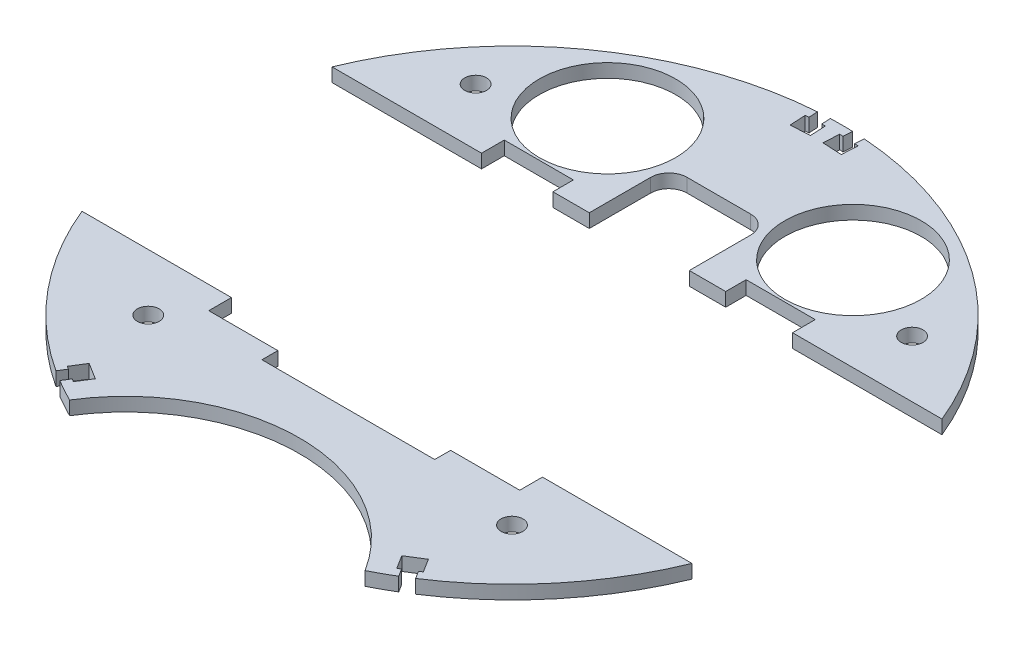
from build123d import *

# Parameters (mm, degrees)
BOSS_EXTRUDE1_DEPTH  = 3
SOLENOID_PLACEMENT_W = 38
SOLENOID_PLACEMENT_H = 64
CUT_EXTRUDE1_DEPTH   = 103.574363269
SKETCH3_R            = 12
CUT_EXTRUDE3_DEPTH   = 103.574363269
SKETCH4_R            = 2.4
CUT_EXTRUDE4_DEPTH   = 103.574363269
CUT_EXTRUDE2_DEPTH   = 103.574363269
CUT_EXTRUDE5_DEPTH   = 99.819279495
SKETCH6_R            = 15
CUT_EXTRUDE10_DEPTH  = 99.819279495
CUT_EXTRUDE11_DEPTH  = 99.819279495


with BuildPart() as part:
    # Sketch1 → Boss-Extrude1 (new body)
    with BuildSketch(Plane(origin=(0, 0, 0), x_dir=(1, 0, 0), z_dir=(0, 1, 0))):
        with BuildLine():
            ThreePointArc((32.48910875, -64.812867647), (0, 72.5), (-32.48910875, -64.812867647))
            ThreePointArc((-32.48910875, -64.812867647), (0, -46.75), (32.48910875, -64.812867647))
        make_face()
    extrude(amount=BOSS_EXTRUDE1_DEPTH)

    # solenoid placement → Cut-Extrude1 (cut, through all)
    with BuildSketch(Plane(origin=(0, 3, 0), x_dir=(1, 0, 0), z_dir=(0, 1, 0))):
        with Locations((0, -4)):
            Rectangle(SOLENOID_PLACEMENT_W, SOLENOID_PLACEMENT_H)
    extrude(amount=-CUT_EXTRUDE1_DEPTH, mode=Mode.SUBTRACT)

    # Sketch3 → Cut-Extrude3 (cut, through all)
    with BuildSketch(Plane(origin=(0, 3, 0), x_dir=(1, 0, 0), z_dir=(0, 1, 0))):
        with Locations((27, 48)):
            Circle(SKETCH3_R)
        with Locations((-27, 48)):
            Circle(SKETCH3_R)
    extrude(amount=-CUT_EXTRUDE3_DEPTH, mode=Mode.SUBTRACT)

    # Sketch4 → Cut-Extrude4 (cut, through all)
    with BuildSketch(Plane(origin=(0, 3, 0), x_dir=(1, 0, 0), z_dir=(0, 1, 0))):
        with Locations((40, -40)):
            Circle(SKETCH4_R)
        with Locations((-40, -40)):
            Circle(SKETCH4_R)
        with Locations((48, 40)):
            Circle(SKETCH4_R)
        with Locations((-48, 40)):
            Circle(SKETCH4_R)
    extrude(amount=-CUT_EXTRUDE4_DEPTH, mode=Mode.SUBTRACT)

    # Sketch2 → Cut-Extrude2 (cut, through all)
    with BuildSketch(Plane(origin=(0, 3, 0), x_dir=(1, 0, 0), z_dir=(0, 1, 0))):
        with BuildLine():
            Line((34.2, -27.5), (34.2, -32.5))
            Line((34.2, -32.5), (22.2, -32.5))
            Line((22.2, -32.5), (19, -32.5))
            Line((19, -32.5), (19, 32.5))
            Line((19, 32.5), (22.2, 32.5))
            Line((22.2, 32.5), (34.2, 32.5))
            Line((34.2, 32.5), (34.2, 27.5))
            Line((34.2, 27.5), (67.082039325, 27.5))
            ThreePointArc((67.082039325, 27.5), (72.5, 0), (67.082039325, -27.5))
            Line((67.082039325, -27.5), (34.2, -27.5))
        make_face()
        with BuildLine():
            Line((-34.2, -32.5), (-22.2, -32.5))
            Line((-22.2, -32.5), (-19, -32.5))
            Line((-19, -32.5), (-19, 32.5))
            Line((-19, 32.5), (-22.2, 32.5))
            Line((-22.2, 32.5), (-34.2, 32.5))
            Line((-34.2, 32.5), (-34.2, 27.5))
            Line((-34.2, 27.5), (-67.082039325, 27.5))
            ThreePointArc((-67.082039325, 27.5), (-72.5, 0), (-67.082039325, -27.5))
            Line((-67.082039325, -27.5), (-34.2, -27.5))
            Line((-34.2, -27.5), (-34.2, -32.5))
        make_face()
    extrude(amount=-CUT_EXTRUDE2_DEPTH, mode=Mode.SUBTRACT)


with BuildPart() as cut_extrude2_piece_1:
    # of the separate pieces the step leaves, piece 1, a body of its own (cut_extrude2_pieces)
    add(part.part.solids().sort_by_distance((67.082039325, 0, -27.5))[0])

    # Sketch5 → Cut-Extrude5 (cut, through all)
    with BuildSketch(Plane(origin=(0, 3, 0), x_dir=(1, 0, 0), z_dir=(0, 1, 0))):
        with BuildLine():
            Line((-11, 41.5), (-11, 28))
            Line((-11, 28), (11, 28))
            Line((11, 28), (11, 41.5))
            ThreePointArc((11, 41.5), (9.828427125, 44.328427125), (7, 45.5))
            Line((7, 45.5), (-7, 45.5))
            ThreePointArc((-7, 45.5), (-9.828427125, 44.328427125), (-11, 41.5))
        make_face()
    extrude(amount=-CUT_EXTRUDE5_DEPTH, mode=Mode.SUBTRACT)

    # Sketch6 → Cut-Extrude10 (cut, through all)
    with BuildSketch(Plane(origin=(0, 3, 0), x_dir=(-1, 0, 0), z_dir=(0, 1, 0))):
        with Locations((-27, -48)):
            Circle(SKETCH6_R)
        with Locations((27, -48)):
            Circle(SKETCH6_R)
    extrude(amount=-CUT_EXTRUDE10_DEPTH, mode=Mode.SUBTRACT)


with BuildPart() as cut_extrude2_piece_2:
    # of the separate pieces the step leaves, piece 2, a body of its own (cut_extrude2_pieces)
    add(part.part.solids().sort_by_distance((32.48910875, 0, 64.812867647))[0])


with BuildPart() as cut_extrude11_tool:
    # Sketch7 → Cut-Extrude11 (new, through all)
    with BuildSketch(Plane(origin=(0, 3, 0), x_dir=(1, 0, 0), z_dir=(0, 1, 0))):
        Polygon((-5.037834787, 70.332728659), (-5.811772676, 70.292168293), (-5.62859683, 66.796964922), (-1.384421307, 67.019392736), (-1.567597154, 70.514596107), (-2.341535043, 70.474035741), (-2.446206956, 72.471294811), (-5.1425067, 72.329987729), align=None)
        Polygon((5.811772676, 70.292168293), (5.037834787, 70.332728659), (5.1425067, 72.329987729), (2.446206956, 72.471294811), (2.341535043, 70.474035741), (1.567597154, 70.514596107), (1.384421307, 67.019392736), (5.62859683, 66.796964922), align=None)
        Polygon((38.504173058, -59.071999772), (39.161410333, -58.661312343), (37.306692908, -55.693144006), (33.702488499, -57.945300879), (35.557205924, -60.913469216), (36.214443199, -60.502781786), (37.274281727, -62.198877978), (39.564011587, -60.768095965), align=None)
        Polygon((-39.161410333, -58.661312343), (-38.504173058, -59.071999772), (-39.564011587, -60.768095965), (-37.274281727, -62.198877978), (-36.214443199, -60.502781786), (-35.557205924, -60.913469216), (-33.702488499, -57.945300879), (-37.306692908, -55.693144006), align=None)
    extrude(amount=-CUT_EXTRUDE11_DEPTH)


with BuildPart() as cut_extrude2_piece_1_1:
    add(cut_extrude2_piece_1.part)

    # Cut-Extrude11: cut by cut_extrude11_tool
    add(cut_extrude11_tool.part, mode=Mode.SUBTRACT)


with BuildPart() as cut_extrude2_piece_2_1:
    add(cut_extrude2_piece_2.part)

    # Cut-Extrude11: cut by cut_extrude11_tool
    add(cut_extrude11_tool.part, mode=Mode.SUBTRACT)


solid = Compound([cut_extrude2_piece_1_1.part, cut_extrude2_piece_2_1.part])
